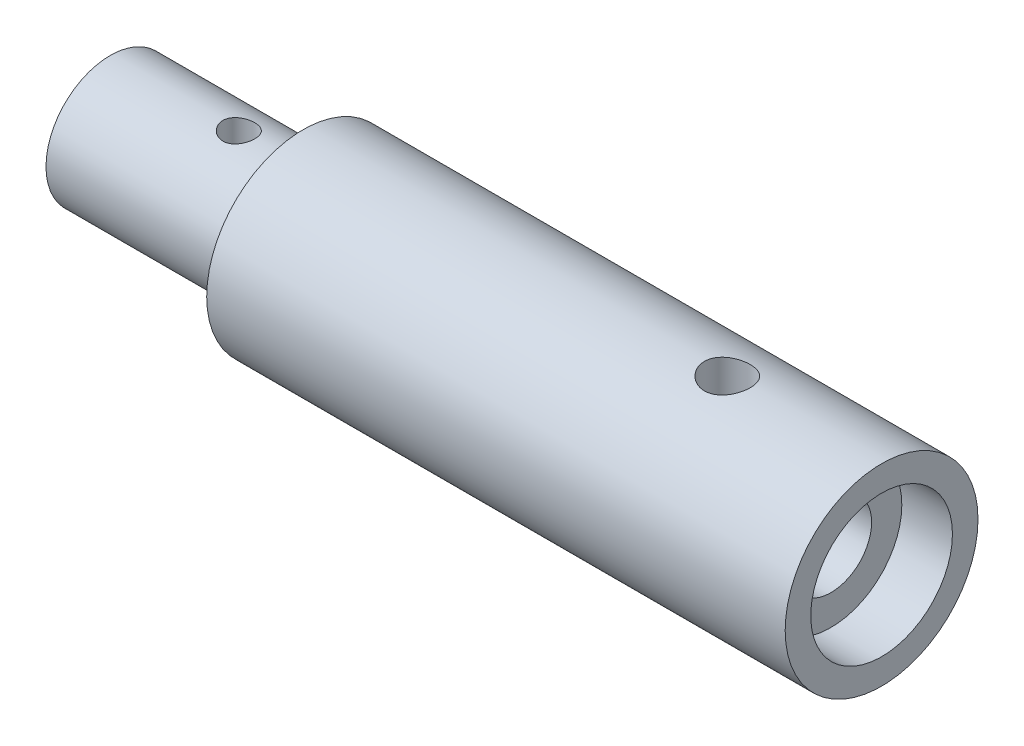
from build123d import *

# Parameters (mm, degrees)
SKETCH1_R               = 4.7625
BOSS_EXTRUDE1_DEPTH     = 38.1
SKETCH2_R               = 2.0066
CUT_EXTRUDE1_DEPTH      = 10.414
SKETCH3_R               = 1.1303
CUT_EXTRUDE2_DEPTH      = 8.6868
SKETCH4_R               = 5.084796601
SKETCH4_R_2             = 3.175
CUT_EXTRUDE3_DEPTH      = 9.525
CUT_EXTRUDE4_DEPTH      = 39.690733028
CUT_EXTRUDE4_DEPTH_BACK = 39.690733028
SKETCH5_R               = 0.7874
SKETCH6_R               = 3.5000057
CUT_EXTRUDE5_DEPTH      = 2.50000008


with BuildPart() as part:
    # Sketch1 → Boss-Extrude1 (new body)
    with BuildSketch(Plane(origin=(0, 0, 0), x_dir=(0, 0, -1), z_dir=(1, 0, 0))):
        Circle(SKETCH1_R)
    extrude(amount=BOSS_EXTRUDE1_DEPTH)

    # Sketch2 → Cut-Extrude1 (cut)
    with BuildSketch(Plane(origin=(38.1, 0, 0), x_dir=(0, 0, -1), z_dir=(1, 0, 0))):
        Circle(SKETCH2_R)
    extrude(amount=-CUT_EXTRUDE1_DEPTH, mode=Mode.SUBTRACT)

    # Sketch3 → Cut-Extrude2 (cut)
    with BuildSketch(Plane(origin=(0, 0, 0), x_dir=(1, 0, 0), z_dir=(0, 1, 0))):
        with Locations((30.48, 0)):
            Circle(SKETCH3_R)
    extrude(amount=CUT_EXTRUDE2_DEPTH, mode=Mode.SUBTRACT)

    # Sketch4 → Cut-Extrude3 (cut)
    with BuildSketch(Plane.ZY):
        Circle(SKETCH4_R)
        Circle(SKETCH4_R_2, mode=Mode.SUBTRACT)
    extrude(amount=-CUT_EXTRUDE3_DEPTH, mode=Mode.SUBTRACT)

    # Sketch5 → Cut-Extrude4 (cut, two sides: drawn at the far end of the back side and taken through both)
    with BuildSketch(Plane(origin=(0, 0, 0), x_dir=(1, 0, 0), z_dir=(0, 1, 0)).offset(-CUT_EXTRUDE4_DEPTH_BACK)):
        with Locations((6.35, 0)):
            Circle(SKETCH5_R)
    extrude(amount=CUT_EXTRUDE4_DEPTH + CUT_EXTRUDE4_DEPTH_BACK, mode=Mode.SUBTRACT)

    # Sketch6 → Cut-Extrude5 (cut)
    with BuildSketch(Plane(origin=(38.1, 0, 0), x_dir=(0, 0, -1), z_dir=(1, 0, 0))):
        Circle(SKETCH6_R)
    extrude(amount=-CUT_EXTRUDE5_DEPTH, mode=Mode.SUBTRACT)


solid = part.part
